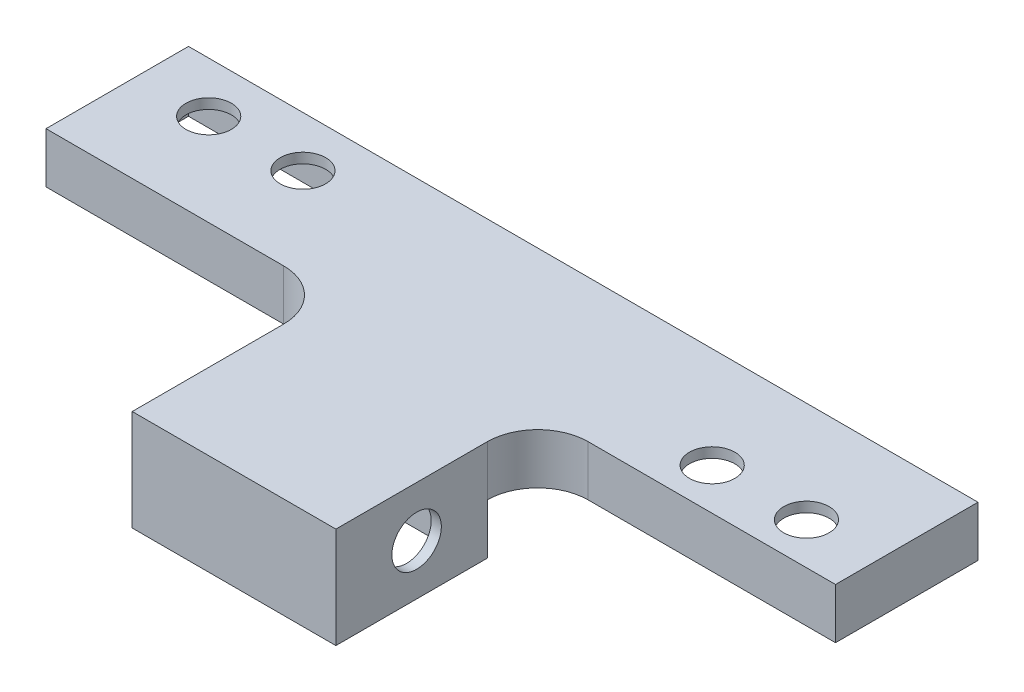
from build123d import *

# Parameters (mm, degrees)
BOSS_EXTRUDE1_DEPTH = 5
SKETCH8_W           = 20.178262132
SKETCH8_H           = 15
BOSS_EXTRUDE2_DEPTH = 5
SHELL4_DEPTH        = 4
SHELL4_START        = -5
SHELL4_2_OUTLINE_W  = 18.178262132
SHELL4_2_OUTLINE_H  = 13
SHELL4_2_DEPTH      = 5
SKETCH9_R           = 2.45
CUT_EXTRUDE3_DEPTH  = 56.455798629
SKETCH10_R          = 2.25
CUT_EXTRUDE4_DEPTH  = 10


# Read off the part's stored shape, not the designer's step: Shell4
with BuildPart() as part:
    # Sketch2 → Boss-Extrude1 (new body)
    with BuildSketch(Plane(origin=(0, 0, 0), x_dir=(1, 0, 0), z_dir=(0, 1, 0))):
        with BuildLine():
            Line((-39.115, 0.880622479), (-39.115, 10))
            Line((-39.115, 10), (39.115, 10))
            Line((39.115, 10), (39.115, 0.880622479))
            Line((39.115, 0.880622479), (39.115, -4.119377521))
            Line((39.115, -4.119377521), (14.608241959, -4.119377521))
            ThreePointArc((14.608241959, -4.119377521), (11.072708053, -5.583843615), (9.608241959, -9.119377521))
            Line((9.608241959, -9.119377521), (9.608241959, -24.119377521))
            Line((9.608241959, -24.119377521), (-10.570020173, -24.119377521))
            Line((-10.570020173, -24.119377521), (-10.570020173, -9.119377521))
            ThreePointArc((-10.570020173, -9.119377521), (-12.034486267, -5.583843615), (-15.570020173, -4.119377521))
            Line((-15.570020173, -4.119377521), (-39.115, -4.119377521))
            Line((-39.115, -4.119377521), (-39.115, 0.880622479))
        make_face()
    extrude(amount=BOSS_EXTRUDE1_DEPTH)

    # Sketch8 → Boss-Extrude2 (add)
    with BuildSketch(Plane.XZ):
        with Locations((-0.480889107, 16.619377521)):
            Rectangle(SKETCH8_W, SKETCH8_H)
    extrude(amount=BOSS_EXTRUDE2_DEPTH)

    # Shell4 outline → Shell4 (cut)
    with BuildSketch(Plane(origin=(0, 0, 0), x_dir=(1, 0, 0), z_dir=(0, 1, 0))):
        with BuildLine():
            Line((38.115, 9), (-38.115, 9))
            Line((-38.115, 9), (-38.115, -3.119377521))
            Line((-38.115, -3.119377521), (-15.570020173, -3.119377521))
            ThreePointArc((-15.570020173, -3.119377521), (-11.327379486, -4.876736834), (-9.570020173, -9.119377521))
            Line((-9.570020173, -9.119377521), (-9.570020173, -23.119377521))
            Line((-9.570020173, -23.119377521), (8.608241959, -23.119377521))
            Line((8.608241959, -23.119377521), (8.608241959, -9.119377521))
            ThreePointArc((8.608241959, -9.119377521), (10.365601272, -4.876736834), (14.608241959, -3.119377521))
            Line((14.608241959, -3.119377521), (38.115, -3.119377521))
            Line((38.115, -3.119377521), (38.115, 9))
        make_face()
    extrude(amount=SHELL4_DEPTH, mode=Mode.SUBTRACT)

    # Shell4 2 outline → Shell4 2 (cut)
    with BuildSketch(Plane(origin=(0, 0, 0), x_dir=(1, 0, 0), z_dir=(0, 1, 0)).offset(SHELL4_START)):
        with Locations((-0.480889107, -16.619377521)):
            Rectangle(SHELL4_2_OUTLINE_W, SHELL4_2_OUTLINE_H)
    extrude(amount=SHELL4_2_DEPTH, mode=Mode.SUBTRACT)

    # Sketch9 → Cut-Extrude3 (cut, through all)
    with BuildSketch(Plane.ZY.offset(10.570020173)):
        with Locations((16.119377521, 0)):
            Circle(SKETCH9_R)
    extrude(amount=-CUT_EXTRUDE3_DEPTH, mode=Mode.SUBTRACT)

    # Sketch10 → Cut-Extrude4 (cut)
    with BuildSketch(Plane(origin=(0, 5, 0), x_dir=(1, 0, 0), z_dir=(0, 1, 0))):
        with Locations(Location((-32.115, 5, 0), (0, 0, 270))):
            Circle(SKETCH10_R)
        with Locations(Location((-22.775, 5, 0), (0, 0, 270))):
            Circle(SKETCH10_R)
        with Locations(Location((32.115, 0, 0), (0, 0, 270))):
            Circle(SKETCH10_R)
        with Locations(Location((22.775, 0, 0), (0, 0, 270))):
            Circle(SKETCH10_R)
    extrude(amount=-CUT_EXTRUDE4_DEPTH, mode=Mode.SUBTRACT)


solid = part.part
